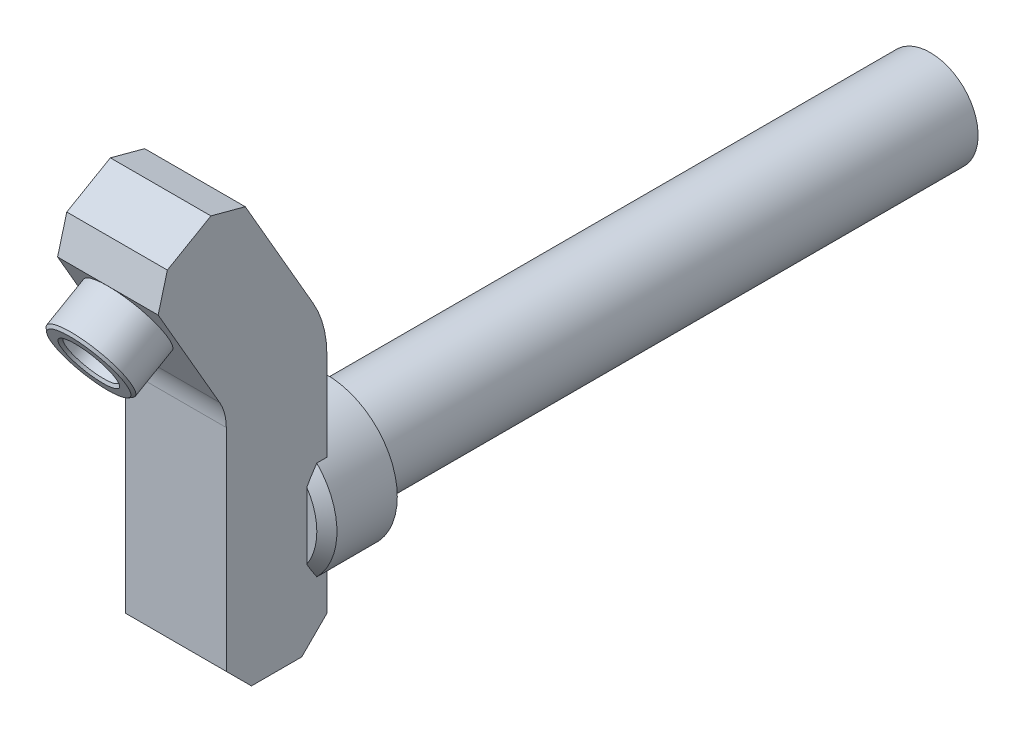
from build123d import *

# Parameters (mm, degrees)
SKETCH1_R           = 9.5
BOSS_EXTRUDE1_DEPTH = 120
CUT_EXTRUDE1_DEPTH  = 40
SKETCH3_R           = 14
SKETCH3_R_2         = 9.5
BOSS_EXTRUDE2_DEPTH = 14
CHAMFER1_SIZE       = 2
BOSS_EXTRUDE3_DEPTH = 10
SKETCH5_R           = 8
BOSS_EXTRUDE4_DEPTH = 9
SKETCH6_R           = 5
CUT_EXTRUDE2_DEPTH  = 169.244076422
CHAMFER2_SIZE       = 0.5
CHAMFER3_SIZE       = 0.5
CHAMFER4_SIZE       = 5


with BuildPart() as part:
    # Sketch1 → Boss-Extrude1 (new body)
    with BuildSketch(Plane.XY):
        Circle(SKETCH1_R)
    extrude(amount=BOSS_EXTRUDE1_DEPTH)

    # Sketch2 → Cut-Extrude1 (cut)
    with BuildSketch(Plane(origin=(0, 0, 0), x_dir=(-1, 0, 0), z_dir=(0, 0, -1))):
        with BuildLine():
            ThreePointArc((9.289473684, 1.988888803), (7.5, 0), (9.289473684, -1.988888803))
            ThreePointArc((9.289473684, -1.988888803), (9.5, 0), (9.289473684, 1.988888803))
        make_face()
    extrude(amount=-CUT_EXTRUDE1_DEPTH, mode=Mode.SUBTRACT)


with BuildPart() as body_2:
    # Sketch3 → Boss-Extrude2 (new body)
    # profile 1 of 2: a face of its own
    with BuildSketch(Plane.XY.offset(120)):
        Circle(SKETCH3_R)
        with Locations(Location((0, 0, 0), (0, 0, 167.915343162))):
            Circle(SKETCH3_R_2, mode=Mode.SUBTRACT)
    # profile 2 of 2: a face of its own
    with BuildSketch(Plane.XY.offset(120)):
        with Locations(Location((0, 0, 0), (0, 0, 167.915343162))):
            Circle(SKETCH3_R_2)
    extrude(amount=BOSS_EXTRUDE2_DEPTH)

    # Chamfer1
    chamfer1_edges = [body_2.edges().sort_by_distance(p)[0] for p in [
        (-14, 0, 134),
    ]]
    chamfer(chamfer1_edges, length=CHAMFER1_SIZE)

    # Sketch4 → Boss-Extrude3 (add, symmetric)
    with BuildSketch(Plane(origin=(0, 0, 0), x_dir=(0, 0, -1), z_dir=(1, 0, 0))):
        with BuildLine():
            Line((-150, -22.088190451), (-130, -22.088190451))
            Line((-130, -22.088190451), (-130, 27.5))
            ThreePointArc((-130, 27.5), (-130.693093967, 32.764571353), (-132.725142661, 37.670370869))
            Line((-132.725142661, 37.670370869), (-148.732107925, 65.39524798))
            Line((-148.732107925, 65.39524798), (-166.052616, 55.39524798))
            Line((-166.052616, 55.39524798), (-151.339745962, 29.911809549))
            ThreePointArc((-151.339745962, 29.911809549), (-150.340741737, 27.5), (-150, 24.911809549))
            Line((-150, 24.911809549), (-150, -22.088190451))
        make_face()
    extrude(amount=BOSS_EXTRUDE3_DEPTH, both=True)

    # Sketch5 → Boss-Extrude4 (add)
    with BuildSketch(Plane(origin=(0, -58.054079916, 100.552616), x_dir=(1, 0, 0), z_dir=(0, -0.4999999999999959, 0.8660254037844412))):
        with Locations(Location((0, 118, 0), (0, 0, 270))):
            Circle(SKETCH5_R)
    extrude(amount=BOSS_EXTRUDE4_DEPTH)

    # Sketch6 → Cut-Extrude2 (cut, through all)
    with BuildSketch(Plane(origin=(0, -62.554079916, 108.346844634), x_dir=(1, 0, 0), z_dir=(0, -0.49999999999999595, 0.866025403784441))):
        with Locations(Location((0, 118, 0), (0, 0, 270))):
            Circle(SKETCH6_R)
    extrude(amount=-CUT_EXTRUDE2_DEPTH, mode=Mode.SUBTRACT)

    # Chamfer2
    chamfer2_edges = [body_2.edges().sort_by_distance(p)[0] for p in [
        (0, 58.46704475, 144.732107925),
        (0, 43.96704475, 169.846844634),
    ]]
    chamfer(chamfer2_edges, length=CHAMFER2_SIZE)

    # Chamfer3
    chamfer3_edges = [body_2.edges().sort_by_distance(p)[0] for p in [
        (0, 46.565120961, 171.346844634),
    ]]
    chamfer(chamfer3_edges, length=CHAMFER3_SIZE)

    # Chamfer4
    chamfer4_edges = [body_2.edges().sort_by_distance(p)[0] for p in [
        (0, -22.088190451, 130),
        (0, 65.39524798, 148.732107925),
        (0, 55.39524798, 166.052616),
        (0, -22.088190451, 150),
    ]]
    chamfer(chamfer4_edges, length=CHAMFER4_SIZE - 0.0001)  # a hair under: the kernel refuses the full size


solid = Compound([part.part, body_2.part])
